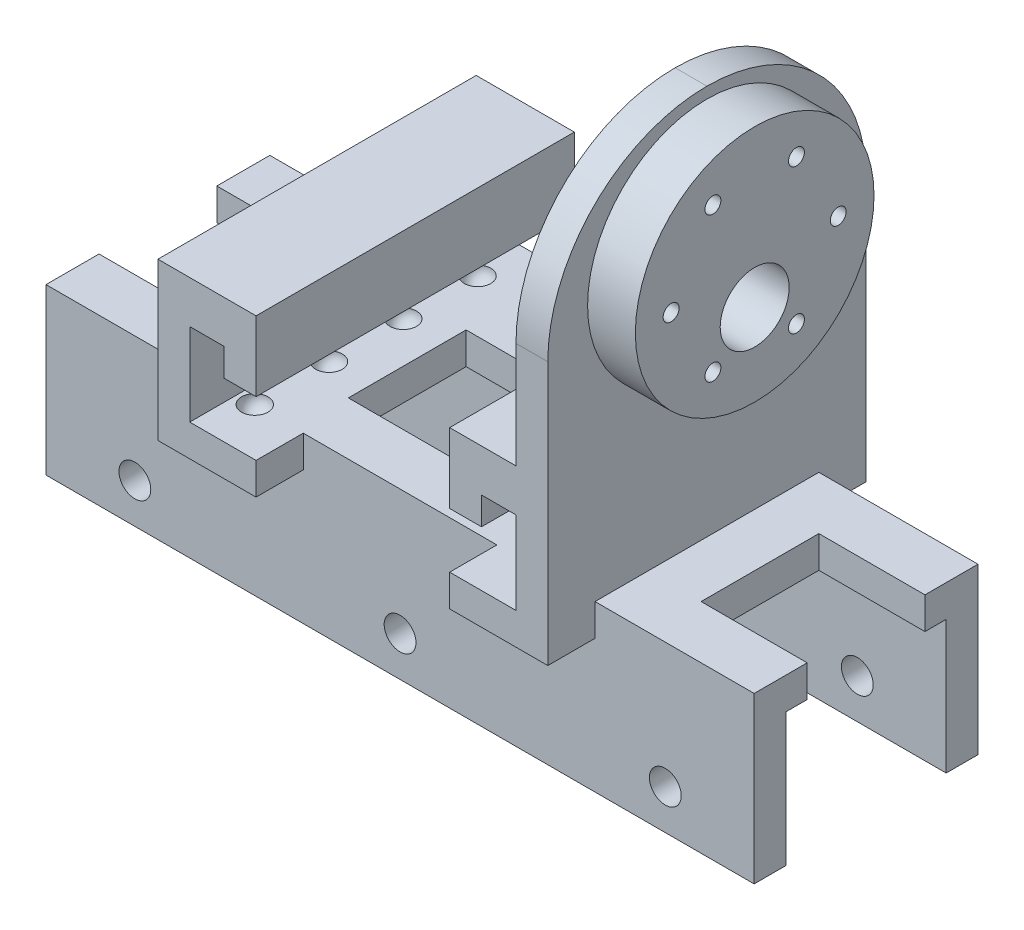
from build123d import *

# Parameters (mm, degrees)
BOSS_EXTRUDE1_DEPTH  = 60
SKETCH2_R            = 1.5
CUT_EXTRUDE1_DEPTH   = 6
LPATTERN1_COUNT      = 4
LPATTERN1_PITCH      = 14
LPATTERN1_COUNT_DIR2 = 2
LPATTERN1_PITCH_DIR2 = 55
SKETCH4_W            = 42.2
SKETCH4_H            = 6
BOSS_EXTRUDE2_DEPTH  = 50
SKETCH5_W            = 42.2
SKETCH5_H            = 6
BOSS_EXTRUDE3_DEPTH  = 50
SKETCH6_W            = 173.5
SKETCH6_H            = 6
BOSS_EXTRUDE4_DEPTH  = 25.1
CIRPATTERN2_COUNT    = 6
SKETCH10_R           = 6.5
CUT_EXTRUDE4_DEPTH   = 10
SKETCH11_R           = 22.5
SKETCH11_R_2         = 1.5
SKETCH11_R_3         = 6.5
BOSS_EXTRUDE6_DEPTH  = 9
SKETCH12_R           = 3
CUT_EXTRUDE5_DEPTH   = 156.56227049
SKETCH13_W           = 30
SKETCH13_H           = 22.2
CUT_EXTRUDE6_DEPTH   = 10
SKETCH14_W           = 40
SKETCH14_H           = 22.2
CUT_EXTRUDE7_DEPTH   = 10
FILLET1_R            = 30
SKETCH15_W           = 36.5
SKETCH15_H           = 8.9
CUT_EXTRUDE8_DEPTH   = 10
SKETCH16_W           = 20
SKETCH16_H           = 31.1
CUT_EXTRUDE9_DEPTH   = 156.56227049


with BuildPart() as part:
    # Sketch1 → Boss-Extrude1 (new body)
    with BuildSketch(Plane.XY):
        Polygon((0, 29.6), (0, 0), (73.5, 0), (73.5, 79.6), (67.5, 79.6), (67.5, 29.6), (55, 29.6), (55, 16.4), (61, 16.4), (61, 21.6), (67.5, 21.6), (67.5, 6), (6, 6), (6, 21.6), (12.5, 21.6), (12.5, 16.4), (18.5, 16.4), (18.5, 29.6), align=None)
    extrude(amount=BOSS_EXTRUDE1_DEPTH)

    # Sketch2 → Cut-Extrude1 (cut)
    with BuildSketch(Plane.ZY.offset(-67.5)):
        with Locations(Location((45.75, 55, 0), (0, 0, 270))):
            Circle(SKETCH2_R)
    cut_extrude1 = extrude(amount=-CUT_EXTRUDE1_DEPTH, mode=Mode.SUBTRACT)

    # Sketch3 → Cut-Revolve1 (revolve, cut)
    with BuildSketch(Plane.XZ.offset(-21.6)):
        with BuildLine():
            Line((61.75, 51), (66.75, 51))
            ThreePointArc((66.75, 51), (64.25, 53.5), (61.75, 51))
        make_face()
    cut_revolve1 = revolve(axis=Axis((61.75, 21.6, 51), (1, 0, 0)), mode=Mode.SUBTRACT)

    # LPattern1: Cut-Revolve1 4 × 2
    with Locations(*[(-j * LPATTERN1_PITCH_DIR2, 0, -i * LPATTERN1_PITCH) for i in range(LPATTERN1_COUNT) for j in range(LPATTERN1_COUNT_DIR2) if (i, j) != (0, 0)]):
        add(cut_revolve1, mode=Mode.SUBTRACT)

    # Sketch4 → Boss-Extrude2 (add)
    with BuildSketch(Plane(origin=(73.5, 0, 0), x_dir=(0, 0, -1), z_dir=(1, 0, 0))):
        with Locations((-30, 3)):
            Rectangle(SKETCH4_W, SKETCH4_H)
    extrude(amount=BOSS_EXTRUDE2_DEPTH)

    # Sketch5 → Boss-Extrude3 (add)
    with BuildSketch(Plane.ZY):
        with Locations((30, 3)):
            Rectangle(SKETCH5_W, SKETCH5_H)
    extrude(amount=BOSS_EXTRUDE3_DEPTH)

    # Sketch6 → Boss-Extrude4 (add)
    with BuildSketch(Plane.XZ):
        with Locations((36.75, 48.1)):
            Rectangle(SKETCH6_W, SKETCH6_H)
        with Locations((36.75, 11.9)):
            Rectangle(SKETCH6_W, SKETCH6_H)
    extrude(amount=BOSS_EXTRUDE4_DEPTH)

    # CirPattern2: Cut-Extrude1 ×6 about axis
    cirpattern2_axis = Axis((0, 55, 30), (1, 0, 0))
    for i in range(1, CIRPATTERN2_COUNT):
        add(cut_extrude1.rotate(cirpattern2_axis, i * 360 / CIRPATTERN2_COUNT), mode=Mode.SUBTRACT)

    # Sketch10 → Cut-Extrude4 (cut)
    with BuildSketch(Plane.ZY.offset(-67.5)):
        with Locations((30, 48)):
            Circle(SKETCH10_R)
    extrude(amount=-CUT_EXTRUDE4_DEPTH, mode=Mode.SUBTRACT)

    # Sketch11 → Boss-Extrude6 (add)
    with BuildSketch(Plane(origin=(73.5, 0, 0), x_dir=(0, 0, -1), z_dir=(1, 0, 0))):
        with Locations(Location((-30, 55, 0), (0, 0, 270))):
            Circle(SKETCH11_R)
        with Locations(Location((-37.875, 68.63990011, 0), (0, 0, 210))):
            Circle(SKETCH11_R_2, mode=Mode.SUBTRACT)
        with Locations(Location((-22.125, 68.63990011, 0), (0, 0, 150))):
            Circle(SKETCH11_R_2, mode=Mode.SUBTRACT)
        with Locations(Location((-14.25, 55, 0), (0, 0, 90))):
            Circle(SKETCH11_R_2, mode=Mode.SUBTRACT)
        with Locations(Location((-22.125, 41.36009989, 0), (0, 0, 90))):
            Circle(SKETCH11_R_2, mode=Mode.SUBTRACT)
        with Locations(Location((-30, 48, 0), (0, 0, 180))):
            Circle(SKETCH11_R_3, mode=Mode.SUBTRACT)
        with Locations(Location((-37.875, 41.36009989, 0), (0, 0, 90))):
            Circle(SKETCH11_R_2, mode=Mode.SUBTRACT)
        with Locations(Location((-45.75, 55, 0), (0, 0, 270))):
            Circle(SKETCH11_R_2, mode=Mode.SUBTRACT)
    extrude(amount=BOSS_EXTRUDE6_DEPTH)

    # Sketch12 → Cut-Extrude5 (cut, through all)
    with BuildSketch(Plane(origin=(0, 0, 8.9), x_dir=(-1, 0, 0), z_dir=(0, 0, -1))):
        with Locations(Location((-36.75, -17.6, 0), (0, 0, 90))):
            Circle(SKETCH12_R)
        with Locations(Location((-86.75, -17.6, 0), (0, 0, 90))):
            Circle(SKETCH12_R)
        with Locations(Location((13.25, -17.6, 0), (0, 0, 90))):
            Circle(SKETCH12_R)
    extrude(amount=-CUT_EXTRUDE5_DEPTH, mode=Mode.SUBTRACT)

    # Mirror2: Cut-Revolve1 across plane
    add(cut_revolve1.mirror(Plane(origin=(0, 13.8, 0), x_dir=(0, 0, 1), z_dir=(0, -1, 0))), mode=Mode.SUBTRACT)

    # Mirror2 copy 1 sketch → Mirror2 copy 1 (revolve, cut)
    with BuildSketch(Plane(origin=(-55, 6, 0), x_dir=(1, 0, 0), z_dir=(0, 1, 0))):
        with BuildLine():
            Line((61.75, -51), (66.75, -51))
            ThreePointArc((66.75, -51), (64.25, -53.5), (61.75, -51))
        make_face()
    revolve(axis=Axis((6.75, 6, 51), (-1, 0, 0)), mode=Mode.SUBTRACT)

    # Mirror2 copy 2 sketch → Mirror2 copy 2 (revolve, cut)
    with BuildSketch(Plane(origin=(0, 6, -14), x_dir=(1, 0, 0), z_dir=(0, 1, 0))):
        with BuildLine():
            Line((61.75, -51), (66.75, -51))
            ThreePointArc((66.75, -51), (64.25, -53.5), (61.75, -51))
        make_face()
    revolve(axis=Axis((61.75, 6, 37), (-1, 0, 0)), mode=Mode.SUBTRACT)

    # Mirror2 copy 3 sketch → Mirror2 copy 3 (revolve, cut)
    with BuildSketch(Plane(origin=(-55, 6, -14), x_dir=(1, 0, 0), z_dir=(0, 1, 0))):
        with BuildLine():
            Line((61.75, -51), (66.75, -51))
            ThreePointArc((66.75, -51), (64.25, -53.5), (61.75, -51))
        make_face()
    revolve(axis=Axis((6.75, 6, 37), (-1, 0, 0)), mode=Mode.SUBTRACT)

    # Mirror2 copy 4 sketch → Mirror2 copy 4 (revolve, cut)
    with BuildSketch(Plane(origin=(0, 6, -28), x_dir=(1, 0, 0), z_dir=(0, 1, 0))):
        with BuildLine():
            Line((61.75, -51), (66.75, -51))
            ThreePointArc((66.75, -51), (64.25, -53.5), (61.75, -51))
        make_face()
    revolve(axis=Axis((61.75, 6, 23), (-1, 0, 0)), mode=Mode.SUBTRACT)

    # Mirror2 copy 5 sketch → Mirror2 copy 5 (revolve, cut)
    with BuildSketch(Plane(origin=(-55, 6, -28), x_dir=(1, 0, 0), z_dir=(0, 1, 0))):
        with BuildLine():
            Line((61.75, -51), (66.75, -51))
            ThreePointArc((66.75, -51), (64.25, -53.5), (61.75, -51))
        make_face()
    revolve(axis=Axis((6.75, 6, 23), (-1, 0, 0)), mode=Mode.SUBTRACT)

    # Mirror2 copy 6 sketch → Mirror2 copy 6 (revolve, cut)
    with BuildSketch(Plane(origin=(0, 6, -42), x_dir=(1, 0, 0), z_dir=(0, 1, 0))):
        with BuildLine():
            Line((61.75, -51), (66.75, -51))
            ThreePointArc((66.75, -51), (64.25, -53.5), (61.75, -51))
        make_face()
    revolve(axis=Axis((61.75, 6, 9), (-1, 0, 0)), mode=Mode.SUBTRACT)

    # Mirror2 copy 7 sketch → Mirror2 copy 7 (revolve, cut)
    with BuildSketch(Plane(origin=(-55, 6, -42), x_dir=(1, 0, 0), z_dir=(0, 1, 0))):
        with BuildLine():
            Line((61.75, -51), (66.75, -51))
            ThreePointArc((66.75, -51), (64.25, -53.5), (61.75, -51))
        make_face()
    revolve(axis=Axis((6.75, 6, 9), (-1, 0, 0)), mode=Mode.SUBTRACT)

    # Sketch13 → Cut-Extrude6 (cut)
    with BuildSketch(Plane(origin=(0, 6, 0), x_dir=(1, 0, 0), z_dir=(0, 1, 0))):
        with Locations((-25, -30)):
            Rectangle(SKETCH13_W, SKETCH13_H)
        with Locations((98.5, -30)):
            Rectangle(SKETCH13_W, SKETCH13_H)
    extrude(amount=-CUT_EXTRUDE6_DEPTH, mode=Mode.SUBTRACT)

    # Sketch14 → Cut-Extrude7 (cut)
    with BuildSketch(Plane(origin=(0, 6, 0), x_dir=(1, 0, 0), z_dir=(0, 1, 0))):
        with Locations((37, -30)):
            Rectangle(SKETCH14_W, SKETCH14_H)
    extrude(amount=-CUT_EXTRUDE7_DEPTH, mode=Mode.SUBTRACT)

    # Fillet1
    fillet1_edges = [part.edges().sort_by_distance(p)[0] for p in [
        (70.5, 79.6, 60),
        (70.5, 79.6, 0),
    ]]
    fillet(fillet1_edges, radius=FILLET1_R - 0.0001)  # a hair under: the kernel refuses the full size

    # Sketch15 → Cut-Extrude8 (cut)
    with BuildSketch(Plane.XZ):
        with Locations((36.75, 55.55)):
            Rectangle(SKETCH15_W, SKETCH15_H)
        with Locations((36.75, 4.45)):
            Rectangle(SKETCH15_W, SKETCH15_H)
    extrude(amount=-CUT_EXTRUDE8_DEPTH, mode=Mode.SUBTRACT)

    # Sketch16 → Cut-Extrude9 (cut, through all)
    with BuildSketch(Plane.XY.offset(51.1)):
        with Locations((-40, -9.55)):
            Rectangle(SKETCH16_W, SKETCH16_H)
        with Locations((113.5, -9.55)):
            Rectangle(SKETCH16_W, SKETCH16_H)
    extrude(amount=-CUT_EXTRUDE9_DEPTH, mode=Mode.SUBTRACT)


solid = part.part
